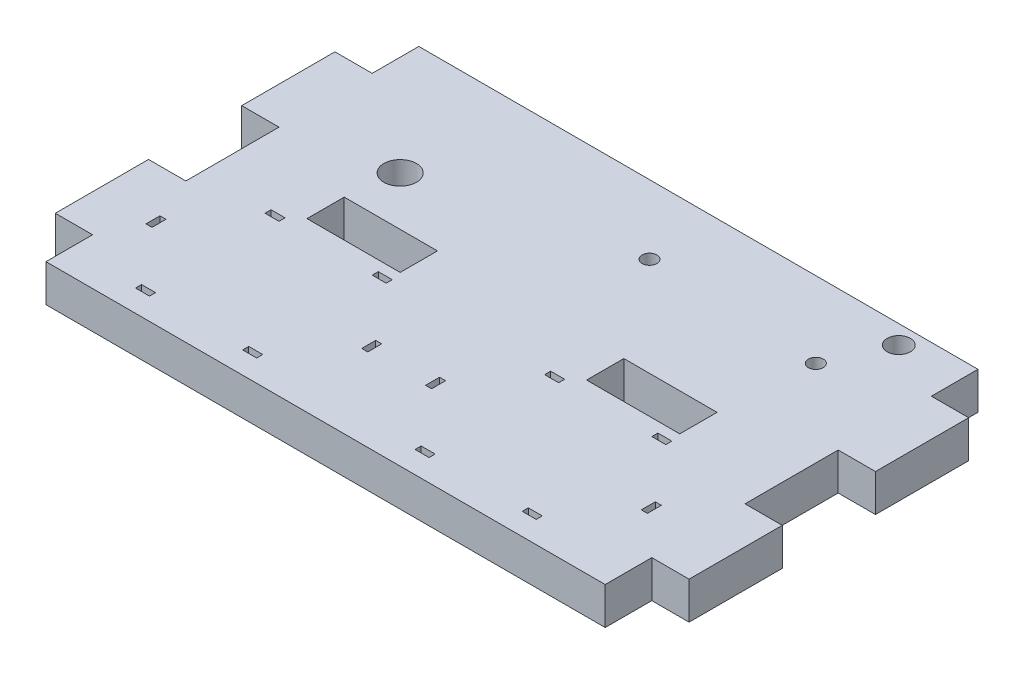
from build123d import *

# Parameters (mm, degrees)
SKETCH1_W           = 120
SKETCH1_H           = 80
SKETCH1_R           = 1.6
SKETCH1_R_2         = 3.5
SKETCH1_R_3         = 2.5
SKETCH1_W_2         = 3
SKETCH1_H_2         = 1.3
SKETCH1_W_3         = 1.3
SKETCH1_H_3         = 3
BOSS_EXTRUDE1_DEPTH = 8
CUT_EXTRUDE1_DEPTH  = 4
SKETCH3_W           = 20
SKETCH3_H           = 8
BOSS_EXTRUDE2_DEPTH = 8
CUT_EXTRUDE3_REACH  = 81.297
SKETCH5_W           = 20
SKETCH5_H           = 8


with BuildPart() as part:
    # Sketch1 → Boss-Extrude1 (new body)
    with BuildSketch(Plane(origin=(0, 0, 0), x_dir=(1, 0, 0), z_dir=(0, 1, 0))):
        Rectangle(SKETCH1_W, SKETCH1_H)
        with Locations((41.5, 23.7)):
            Circle(SKETCH1_R, mode=Mode.SUBTRACT)
        with Locations((4.3, 25.2)):
            Circle(SKETCH1_R, mode=Mode.SUBTRACT)
        with Locations((-38.5, 14.5)):
            Circle(SKETCH1_R_2, mode=Mode.SUBTRACT)
        with Locations((47, 36)):
            Circle(SKETCH1_R_3, mode=Mode.SUBTRACT)
        with Locations((39, -6.85)):
            Rectangle(SKETCH1_W_2, SKETCH1_H_2, mode=Mode.SUBTRACT)
        with Locations((16, -6.85)):
            Rectangle(SKETCH1_W_2, SKETCH1_H_2, mode=Mode.SUBTRACT)
        with Locations((4.35, -20.75)):
            Rectangle(SKETCH1_W_3, SKETCH1_H_3, mode=Mode.SUBTRACT)
        with Locations((50.65, -20.75)):
            Rectangle(SKETCH1_W_3, SKETCH1_H_3, mode=Mode.SUBTRACT)
        with Locations((39, -34.65)):
            Rectangle(SKETCH1_W_2, SKETCH1_H_2, mode=Mode.SUBTRACT)
        with Locations((16, -34.65)):
            Rectangle(SKETCH1_W_2, SKETCH1_H_2, mode=Mode.SUBTRACT)
        with Locations((-21, -34.65)):
            Rectangle(SKETCH1_W_2, SKETCH1_H_2, mode=Mode.SUBTRACT)
        with Locations((-44, -34.65)):
            Rectangle(SKETCH1_W_2, SKETCH1_H_2, mode=Mode.SUBTRACT)
        with Locations((-55.65, -20.75)):
            Rectangle(SKETCH1_W_3, SKETCH1_H_3, mode=Mode.SUBTRACT)
        with Locations((-44, -6.85)):
            Rectangle(SKETCH1_W_2, SKETCH1_H_2, mode=Mode.SUBTRACT)
        with Locations((-9.35, -20.75)):
            Rectangle(SKETCH1_W_3, SKETCH1_H_3, mode=Mode.SUBTRACT)
        with Locations((-21, -6.85)):
            Rectangle(SKETCH1_W_2, SKETCH1_H_2, mode=Mode.SUBTRACT)
    extrude(amount=BOSS_EXTRUDE1_DEPTH)

    # Sketch2 → Cut-Extrude1 (cut)
    with BuildSketch(Plane(origin=(0, 0, 0), x_dir=(-1, 0, 0), z_dir=(0, -1, 0))):
        Polygon((-7.475426481, 25.2), (-5.88771324, 22.45), (-2.71228676, 22.45), (-1.124573519, 25.2), (-2.71228676, 27.95), (-5.88771324, 27.95), align=None)
        Polygon((-44.675426481, 23.7), (-43.08771324, 20.95), (-39.91228676, 20.95), (-38.324573519, 23.7), (-39.91228676, 26.45), (-43.08771324, 26.45), align=None)
    extrude(amount=-CUT_EXTRUDE1_DEPTH, mode=Mode.SUBTRACT)

    # Sketch3 → Boss-Extrude2 (add)
    with BuildSketch(Plane.ZY.offset(60)):
        with Locations((-20, 4)):
            Rectangle(SKETCH3_W, SKETCH3_H)
        with Locations((20, 4)):
            Rectangle(SKETCH3_W, SKETCH3_H)
    boss_extrude2 = extrude(amount=BOSS_EXTRUDE2_DEPTH)

    # Mirror1: Boss-Extrude2 across plane
    add(boss_extrude2.mirror(Plane.ZY))

    # Sketch5 → Cut-Extrude3 (cut, up to next)
    with BuildSketch(Plane(origin=(0, 0, 0), x_dir=(-1, 0, 0), z_dir=(0, -1, 0)), mode=Mode.PRIVATE) as cut_extrude3_sk1:
        with Locations((30, 0)):
            Rectangle(SKETCH5_W, SKETCH5_H)
    cut_extrude3_tool1 = extrude(cut_extrude3_sk1.sketch, amount=-CUT_EXTRUDE3_REACH, mode=Mode.PRIVATE) & part.part
    cut_extrude3 = cut_extrude3_tool1.solids().sort_by_distance((-30, 0, 0))[0]
    add(cut_extrude3, mode=Mode.SUBTRACT)

    # Mirror2: Cut-Extrude3 across plane
    add(cut_extrude3.mirror(Plane.ZY), mode=Mode.SUBTRACT)


solid = part.part
